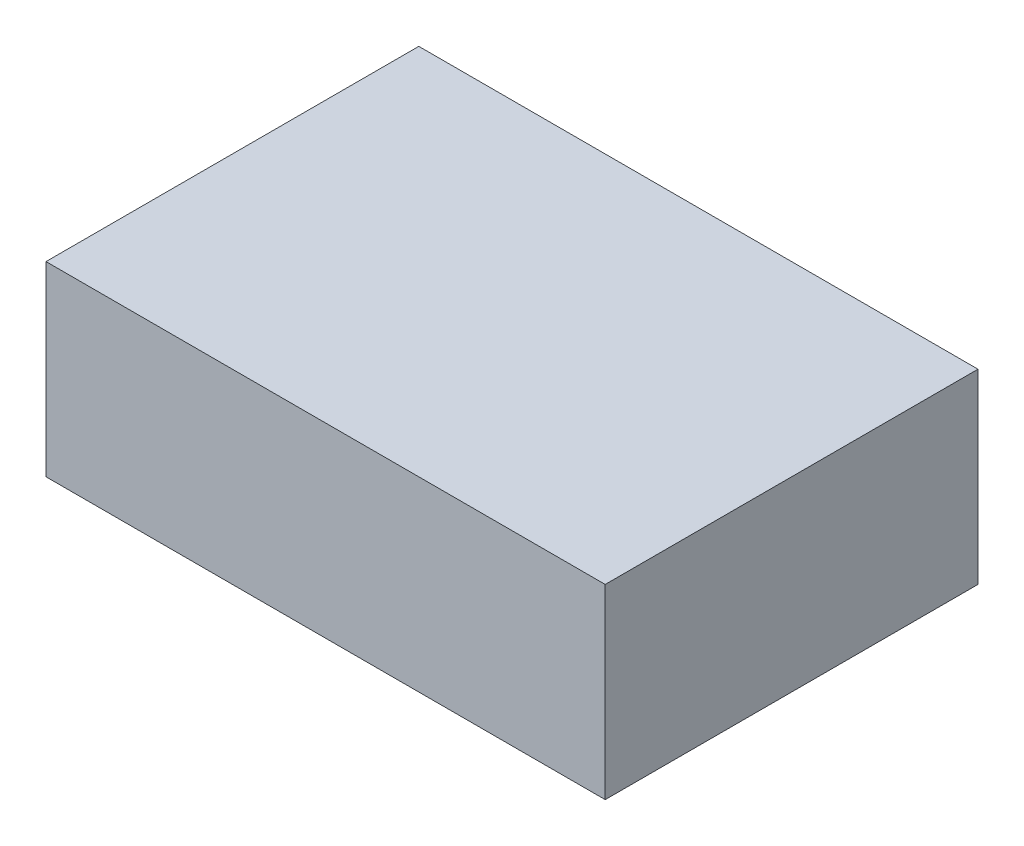
from build123d import *

# Parameters (mm, degrees)
SKETCH2_W           = 152.4
SKETCH2_H           = 101.6
BOSS_EXTRUDE1_DEPTH = 25.4


with BuildPart() as part:
    # Sketch2 → Boss-Extrude1 (new, symmetric)
    with BuildSketch(Plane(origin=(0, 0, 0), x_dir=(1, 0, 0), z_dir=(0, 1, 0))):
        Rectangle(SKETCH2_W, SKETCH2_H)
    extrude(amount=BOSS_EXTRUDE1_DEPTH, both=True)


solid = part.part
